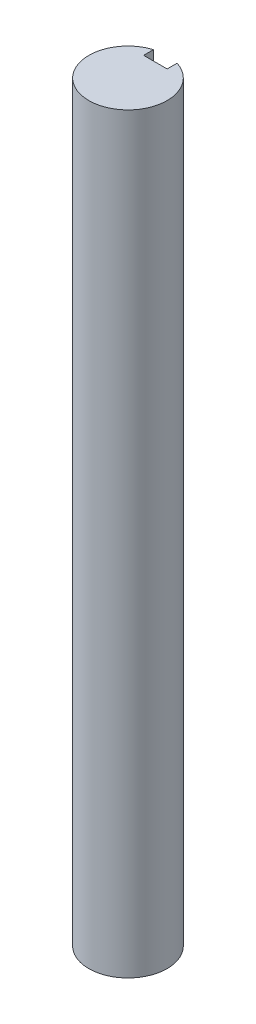
from build123d import *

# Parameters (mm, degrees)
BOSS_EXTRUDE1_DEPTH = 38.1


with BuildPart() as part:
    # Sketch1 → Boss-Extrude1 (new, symmetric)
    with BuildSketch(Plane(origin=(0, 0, 0), x_dir=(1, 0, 0), z_dir=(0, 1, 0))):
        with BuildLine():
            Line((-1.1938, 3.784946251), (-1.1938, 2.778125))
            Line((-1.1938, 2.778125), (0, 2.778125))
            Line((0, 2.778125), (1.1938, 2.778125))
            Line((1.1938, 2.778125), (1.1938, 3.784946251))
            ThreePointArc((1.1938, 3.784946251), (0, -3.96875), (-1.1938, 3.784946251))
        make_face()
    extrude(amount=BOSS_EXTRUDE1_DEPTH, both=True)


solid = part.part
